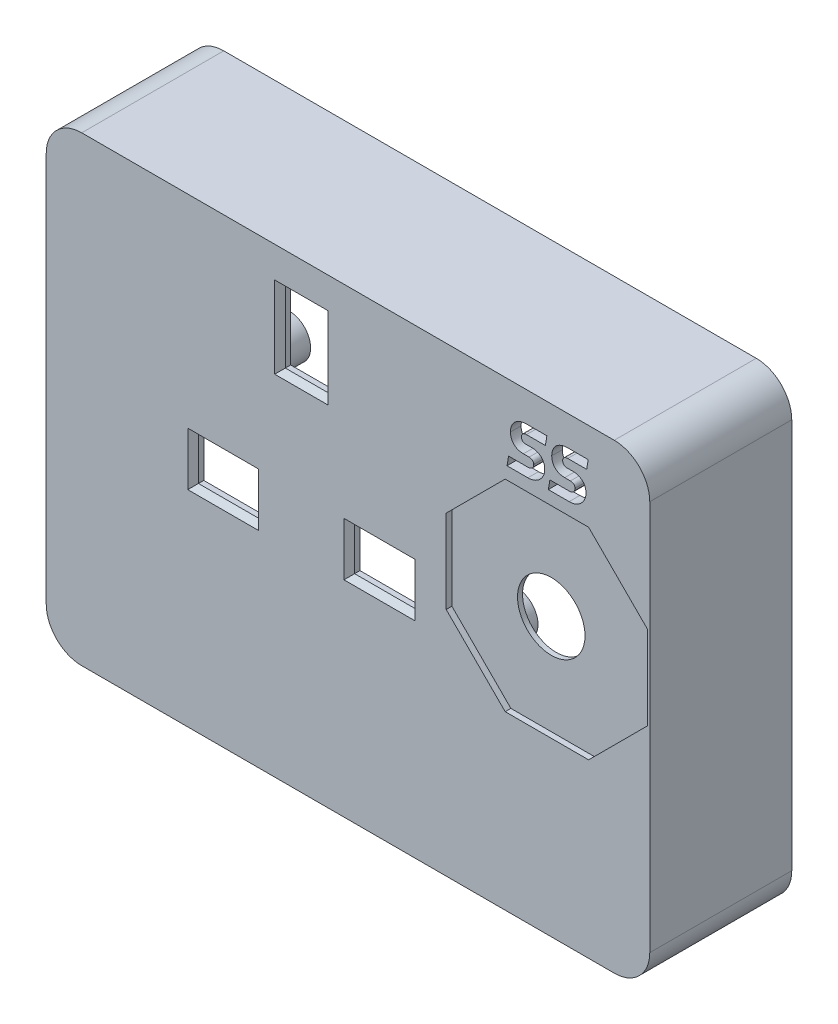
from build123d import *

# Parameters (mm, degrees)
BOSS_EXTRUDE1_DEPTH          = 20
SHELL5_T                     = -1.5
SKETCH2_W                    = 5.8
SKETCH2_H                    = 9.81
CUT_EXTRUDE2_DEPTH           = 0.8
CUT_EXTRUDE2_DRAFT           = -45
SKETCH2_W_2                  = 9.39
SKETCH2_H_2                  = 5.8
CUT_EXTRUDE2_PROFILE_2_DEPTH = 0.8
CUT_EXTRUDE2_PROFILE_2_DRAFT = -45
CUT_EXTRUDE2_PROFILE_3_DEPTH = 0.8
CUT_EXTRUDE2_PROFILE_3_DRAFT = -45
SKETCH11_W                   = 4.2
SKETCH11_H                   = 8.21
SKETCH11_W_2                 = 7.79
SKETCH11_H_2                 = 4.2
CUT_EXTRUDE3_DEPTH           = 2
CUT_EXTRUDE5_DEPTH           = 1.5
SKETCH18_W                   = 1
SKETCH18_H                   = 4
BOSS_EXTRUDE2_DEPTH          = 3
SKETCH19_W                   = 67.604409418
SKETCH19_H                   = 1.025126266
BOSS_EXTRUDE3_DEPTH          = 1
EXTRUDE_THIN2_OUTLINE_R      = 3
EXTRUDE_THIN2_OUTLINE_R_2    = 1.5
EXTRUDE_THIN2_DEPTH          = 7
SKETCH24_W                   = 3
SKETCH24_H                   = 1
BOSS_EXTRUDE8_DEPTH          = 3
BOSS_EXTRUDE9_DEPTH          = 4
SKETCH27_W                   = 1
SKETCH27_H                   = 4.5
BOSS_EXTRUDE10_DEPTH         = 4
SKETCH27_3_W                 = 1
SKETCH27_3_H                 = 3
BOSS_EXTRUDE11_DEPTH         = 2
SKETCH29_R                   = 4.75
CUT_EXTRUDE9_DEPTH           = 4
SKETCH33_W                   = 9.39
SKETCH33_H                   = 5.8
SKETCH33_W_2                 = 5.8
SKETCH33_H_2                 = 9.81
BOSS_EXTRUDE12_DEPTH         = 1.5
SKETCH34_W                   = 8.48
SKETCH34_H                   = 6
SKETCH34_W_2                 = 6.48
SKETCH34_H_2                 = 4
SKETCH34_W_3                 = 6
SKETCH34_H_3                 = 10
SKETCH34_W_4                 = 4
SKETCH34_H_4                 = 8
CUT_EXTRUDE11_DEPTH          = 1.5
CHAMFER1_SIZE                = 0.75
SKETCH35_R                   = 3
SKETCH35_R_2                 = 1.5
EXTRUDE_THIN3_DEPTH          = 7
CUT_EXTRUDE12_DEPTH          = 2
CUT_EXTRUDE13_DEPTH          = 0.8


# Read off the part's stored shape, not the designer's step: Extrude-Thin2
with BuildPart() as part:
    # Sketch1 → Boss-Extrude1 (new body)
    with BuildSketch(Plane.XY):
        with BuildLine():
            Line((5, 0), (80, 0))
            ThreePointArc((80, 0), (83.535533906, -1.464466094), (85, -5))
            Line((85, -5), (85, -60))
            ThreePointArc((85, -60), (83.535533906, -63.535533906), (80, -65))
            Line((80, -65), (5, -65))
            ThreePointArc((5, -65), (1.464466094, -63.535533906), (0, -60))
            Line((0, -60), (0, -5))
            ThreePointArc((0, -5), (1.464466094, -1.464466094), (5, 0))
        make_face()
    extrude(amount=BOSS_EXTRUDE1_DEPTH)

    # Shell5
    shell5_openings = [part.faces().sort_by_distance(p)[0] for p in [
        (42.5, -32.5, 0),
    ]]
    offset(amount=SHELL5_T, openings=shell5_openings, kind=Kind.INTERSECTION)


with BuildPart() as cut_extrude2_tool:
    # Sketch2 → Cut-Extrude2 (with draft: the straight prism first)
    with BuildSketch(Plane.XY.offset(20)):
        with Locations((35.750734439, -10.039101851)):
            Rectangle(SKETCH2_W, SKETCH2_H)
    extrude(amount=-CUT_EXTRUDE2_DEPTH)
    # Cut-Extrude2: the draft: its side faces are tilted about the plane it starts from
    cut_extrude2_sides = [cut_extrude2_tool.faces().sort_by_distance(p)[0] for p in [
        (35.750734439, -5.134101851, 19.6),
        (32.850734439, -10.039101851, 19.6),
        (35.750734439, -14.944101851, 19.6),
        (38.650734439, -10.039101851, 19.6),
    ]]
    draft(cut_extrude2_sides, Plane.XY.offset(20), CUT_EXTRUDE2_DRAFT)


with BuildPart() as part_1:
    add(part.part)

    # Cut-Extrude2: cut by cut_extrude2_tool
    add(cut_extrude2_tool.part, mode=Mode.SUBTRACT)


with BuildPart() as cut_extrude2_profile_2_tool:
    # Sketch2 → Cut-Extrude2 profile 2 (with draft: the straight prism first)
    with BuildSketch(Plane.XY.offset(20)):
        with Locations((24.750734439, -32.439587307)):
            Rectangle(SKETCH2_W_2, SKETCH2_H_2)
    extrude(amount=-CUT_EXTRUDE2_PROFILE_2_DEPTH)
    # Cut-Extrude2 profile 2: the draft: its side faces are tilted about the plane it starts from
    cut_extrude2_profile_2_sides = [cut_extrude2_profile_2_tool.faces().sort_by_distance(p)[0] for p in [
        (20.055734439, -32.439587307, 19.6),
        (24.750734439, -35.339587307, 19.6),
        (29.445734439, -32.439587307, 19.6),
        (24.750734439, -29.539587307, 19.6),
    ]]
    draft(cut_extrude2_profile_2_sides, Plane.XY.offset(20), CUT_EXTRUDE2_PROFILE_2_DRAFT)


with BuildPart() as part_2:
    add(part_1.part)

    # Cut-Extrude2 profile 2: cut by cut_extrude2_profile_2_tool
    add(cut_extrude2_profile_2_tool.part, mode=Mode.SUBTRACT)


with BuildPart() as cut_extrude2_profile_3_tool:
    # Sketch2 → Cut-Extrude2 profile 3 (with draft: the straight prism first)
    with BuildSketch(Plane.XY.offset(20)):
        with Locations((45.820734439, -32.151016376)):
            Rectangle(SKETCH2_W_2, SKETCH2_H_2)
    extrude(amount=-CUT_EXTRUDE2_PROFILE_3_DEPTH)
    # Cut-Extrude2 profile 3: the draft: its side faces are tilted about the plane it starts from
    cut_extrude2_profile_3_sides = [cut_extrude2_profile_3_tool.faces().sort_by_distance(p)[0] for p in [
        (45.820734439, -35.051016376, 19.6),
        (50.515734439, -32.151016376, 19.6),
        (45.820734439, -29.251016376, 19.6),
        (41.125734439, -32.151016376, 19.6),
    ]]
    draft(cut_extrude2_profile_3_sides, Plane.XY.offset(20), CUT_EXTRUDE2_PROFILE_3_DRAFT)


with BuildPart() as part_3:
    add(part_2.part)

    # Cut-Extrude2 profile 3: cut by cut_extrude2_profile_3_tool
    add(cut_extrude2_profile_3_tool.part, mode=Mode.SUBTRACT)

    # Sketch11 → Cut-Extrude3 (cut)
    with BuildSketch(Plane.XY.offset(20)):
        with Locations((35.750734439, -10.039101851)):
            Rectangle(SKETCH11_W, SKETCH11_H)
        with Locations((45.820734439, -32.151016376)):
            Rectangle(SKETCH11_W_2, SKETCH11_H_2)
        with Locations((24.750734439, -32.439587307)):
            Rectangle(SKETCH11_W_2, SKETCH11_H_2)
    extrude(amount=-CUT_EXTRUDE3_DEPTH, mode=Mode.SUBTRACT)

    # Sketch12 → Cut-Extrude5 (cut)
    with BuildSketch(Plane(origin=(0, 0, 0), x_dir=(-1, 0, 0), z_dir=(0, 0, -1))):
        with BuildLine():
            Line((-1, -60), (-1, -5))
            ThreePointArc((-1, -5), (-2.171572875, -2.171572875), (-5, -1))
            Line((-5, -1), (-80, -1))
            ThreePointArc((-80, -1), (-82.828427125, -2.171572875), (-84, -5))
            Line((-84, -5), (-84, -60))
            ThreePointArc((-84, -60), (-82.828427125, -62.828427125), (-80, -64))
            Line((-80, -64), (-5, -64))
            ThreePointArc((-5, -64), (-2.171572875, -62.828427125), (-1, -60))
        make_face()
    extrude(amount=-CUT_EXTRUDE5_DEPTH, mode=Mode.SUBTRACT)

    # Sketch18 → Boss-Extrude2 (add)
    with BuildSketch(Plane(origin=(0, 0, 18.5), x_dir=(-1, 0, 0), z_dir=(0, 0, -1))):
        with Locations((-20.291181164, -61.5)):
            Rectangle(SKETCH18_W, SKETCH18_H)
        with Locations((-43.743706014, -61.5)):
            Rectangle(SKETCH18_W, SKETCH18_H)
        with Locations((-52.686382066, -61.5)):
            Rectangle(SKETCH18_W, SKETCH18_H)
        with Locations((-72.486417139, -61.5)):
            Rectangle(SKETCH18_W, SKETCH18_H)
    extrude(amount=BOSS_EXTRUDE2_DEPTH)

    # Sketch19 → Boss-Extrude3 (add)
    with BuildSketch(Plane(origin=(0, 0, 18.5), x_dir=(-1, 0, 0), z_dir=(0, 0, -1))):
        with Locations((-46.197795291, -62.987436867)):
            Rectangle(SKETCH19_W, SKETCH19_H)
    extrude(amount=BOSS_EXTRUDE3_DEPTH)

    # Extrude-Thin2 outline → Extrude-Thin2 (add)
    # profile 1 of 3: a face of its own
    with BuildSketch(Plane(origin=(0, 0, 18.5), x_dir=(-1, 0, 0), z_dir=(0, 0, -1))):
        with Locations((-58.013044206, -7.100045218)):
            Circle(EXTRUDE_THIN2_OUTLINE_R)
        with Locations((-58.013044206, -7.100045218)):
            Circle(EXTRUDE_THIN2_OUTLINE_R_2, mode=Mode.SUBTRACT)
    # profile 2 of 3: a face of its own
    with BuildSketch(Plane(origin=(0, 0, 18.5), x_dir=(-1, 0, 0), z_dir=(0, 0, -1))):
        with Locations((-57.762473778, -36.347616319)):
            Circle(EXTRUDE_THIN2_OUTLINE_R)
        with Locations((-57.762473778, -36.347616319)):
            Circle(EXTRUDE_THIN2_OUTLINE_R_2, mode=Mode.SUBTRACT)
    # profile 3 of 3: a face of its own
    with BuildSketch(Plane(origin=(0, 0, 18.5), x_dir=(-1, 0, 0), z_dir=(0, 0, -1))):
        with Locations((-80.011530807, -7.095829284)):
            Circle(EXTRUDE_THIN2_OUTLINE_R)
        with Locations((-80.011530807, -7.095829284)):
            Circle(EXTRUDE_THIN2_OUTLINE_R_2, mode=Mode.SUBTRACT)
    extrude(amount=EXTRUDE_THIN2_DEPTH)

    # Sketch24 → Boss-Extrude8 (add)
    with BuildSketch(Plane(origin=(0, 0, 18.5), x_dir=(-1, 0, 0), z_dir=(0, 0, -1))):
        with Locations((-3, -15.410950244)):
            Rectangle(SKETCH24_W, SKETCH24_H)
        with Locations((-3, -33)):
            Rectangle(SKETCH24_W, SKETCH24_H)
        with Locations((-3, -41.503906467)):
            Rectangle(SKETCH24_W, SKETCH24_H)
    extrude(amount=BOSS_EXTRUDE8_DEPTH)

    # Sketch25 → Boss-Extrude9 (add)
    with BuildSketch(Plane(origin=(0, 0, 18.5), x_dir=(-1, 0, 0), z_dir=(0, 0, -1))):
        Polygon((-5, -58.3), (-6.3, -58.3), (-6.3, -63.5), (-5, -63.5), (-1.477724986, -63.5), (-1.477724986, -58.3), align=None)
    extrude(amount=BOSS_EXTRUDE9_DEPTH)

    # Sketch27 → Boss-Extrude10 (add)
    with BuildSketch(Plane(origin=(0, 0, 18.5), x_dir=(-1, 0, 0), z_dir=(0, 0, -1))):
        Polygon((-7.590273025, -58.3), (-6.3, -58.3), (-6.090273025, -58.3), (-6.090273025, -53.8), (-7.590273025, -53.8), align=None)
        with Locations((-3.090273025, -56.05)):
            Rectangle(SKETCH27_W, SKETCH27_H)
    extrude(amount=BOSS_EXTRUDE10_DEPTH)

    # Sketch27<3> → Boss-Extrude11 (add)
    with BuildSketch(Plane(origin=(0, 0, 18.5), x_dir=(-1, 0, 0), z_dir=(0, 0, -1))):
        Polygon((-7.623895655, -37.278874561), (-6.33362263, -37.278874561), (-6.123895655, -37.278874561), (-6.123895655, -34.278874561), (-7.623895655, -34.278874561), align=None)
        with Locations((-3.123895655, -35.778874561)):
            Rectangle(SKETCH27_3_W, SKETCH27_3_H)
        Polygon((-7.295852062, -21.696517585), (-6.005579038, -21.696517585), (-5.795852062, -21.696517585), (-5.795852062, -18.696517585), (-7.295852062, -18.696517585), align=None)
        with Locations((-2.795852062, -20.196517585)):
            Rectangle(SKETCH27_3_W, SKETCH27_3_H)
    extrude(amount=BOSS_EXTRUDE11_DEPTH)

    # Sketch29 → Cut-Extrude9 (cut)
    with BuildSketch(Plane.XY.offset(20)):
        with Locations((70.328450686, -26.717149062)):
            Circle(SKETCH29_R)
    extrude(amount=-CUT_EXTRUDE9_DEPTH, mode=Mode.SUBTRACT)

    # Sketch33 → Boss-Extrude12 (add)
    with BuildSketch(Plane.XY.offset(20)):
        with Locations((24.750734439, -32.439587307)):
            Rectangle(SKETCH33_W, SKETCH33_H)
        with Locations((45.820734439, -32.151016376)):
            Rectangle(SKETCH33_W, SKETCH33_H)
        with Locations((35.750734439, -10.039101851)):
            Rectangle(SKETCH33_W_2, SKETCH33_H_2)
    extrude(amount=-BOSS_EXTRUDE12_DEPTH)

    # Sketch34 → Cut-Extrude11 (cut)
    # profile 1 of 6: a face of its own
    with BuildSketch(Plane.XY.offset(20)):
        with Locations((46.925110998, -32.304599148)):
            Rectangle(SKETCH34_W, SKETCH34_H)
        with Locations((46.925110998, -32.304599148)):
            Rectangle(SKETCH34_W_2, SKETCH34_H_2, mode=Mode.SUBTRACT)
    # profile 2 of 6: a face of its own
    with BuildSketch(Plane.XY.offset(20)):
        with Locations((46.925110998, -32.304599148)):
            Rectangle(SKETCH34_W_2, SKETCH34_H_2)
    # profile 3 of 6: a face of its own
    with BuildSketch(Plane.XY.offset(20)):
        with Locations((24.925110998, -32.304599148)):
            Rectangle(SKETCH34_W, SKETCH34_H)
        with Locations((24.925110998, -32.304599148)):
            Rectangle(SKETCH34_W_2, SKETCH34_H_2, mode=Mode.SUBTRACT)
    # profile 4 of 6: a face of its own
    with BuildSketch(Plane.XY.offset(20)):
        with Locations((24.925110998, -32.304599148)):
            Rectangle(SKETCH34_W_2, SKETCH34_H_2)
    # profile 5 of 6: a face of its own
    with BuildSketch(Plane.XY.offset(20)):
        with Locations((35.925110998, -10.104599148)):
            Rectangle(SKETCH34_W_3, SKETCH34_H_3)
        with Locations((35.925110998, -10.104599148)):
            Rectangle(SKETCH34_W_4, SKETCH34_H_4, mode=Mode.SUBTRACT)
    # profile 6 of 6: a face of its own
    with BuildSketch(Plane.XY.offset(20)):
        with Locations((35.925110998, -10.104599148)):
            Rectangle(SKETCH34_W_4, SKETCH34_H_4)
    extrude(amount=-CUT_EXTRUDE11_DEPTH, mode=Mode.SUBTRACT)

    # Chamfer1
    chamfer1_edges = [part_3.edges().sort_by_distance(p)[0] for p in [
        (42.685110998, -32.304599148, 20),
        (46.925110998, -29.304599148, 20),
        (51.165110998, -32.304599148, 20),
        (46.925110998, -35.304599148, 20),
        (20.685110998, -32.304599148, 20),
        (24.925110998, -29.304599148, 20),
        (29.165110998, -32.304599148, 20),
        (24.925110998, -35.304599148, 20),
        (32.925110998, -10.104599148, 20),
        (35.925110998, -15.104599148, 20),
        (38.925110998, -10.104599148, 20),
        (35.925110998, -5.104599148, 20),
    ]]
    chamfer(chamfer1_edges, length=CHAMFER1_SIZE)

    # Sketch35 → Extrude-Thin3 (add)
    # profile 1 of 2: a face of its own
    with BuildSketch(Plane(origin=(0, 0, 18.5), x_dir=(-1, 0, 0), z_dir=(0, 0, -1))):
        with Locations((-25.737610309, -18.622939682)):
            Circle(SKETCH35_R)
        with Locations((-25.737610309, -18.622939682)):
            Circle(SKETCH35_R_2, mode=Mode.SUBTRACT)
    # profile 2 of 2: a face of its own
    with BuildSketch(Plane(origin=(0, 0, 18.5), x_dir=(-1, 0, 0), z_dir=(0, 0, -1))):
        with Locations((-46.08232423, -18.622939682)):
            Circle(SKETCH35_R)
        with Locations((-46.08232423, -18.622939682)):
            Circle(SKETCH35_R_2, mode=Mode.SUBTRACT)
    extrude(amount=EXTRUDE_THIN3_DEPTH)

    # Sketch37 → Cut-Extrude12 (cut)
    with BuildSketch(Plane.XY.offset(20)):
        with BuildLine():
            Line((64.89804713, -10.661370231), (65.119799828, -9.368258109))
            Line((65.119799828, -9.368258109), (67.824915579, -9.368258109))
            add(Edge.make_bspline(
                [(67.824915579, -9.368258109), (67.869507816, -9.366956356), (67.95510518, -9.364457566), (68.077739329, -9.3460825), (68.188278875, -9.314105443), (68.287012833, -9.269570527), (68.373868451, -9.214705621), (68.449784089, -9.151675241), (68.513169063, -9.079700136), (68.5661532, -9.000503764), (68.605525641, -8.912995962), (68.635404062, -8.820380769), (68.653180335, -8.721937237), (68.654928902, -8.654535876), (68.655820268, -8.620176717)],
                knots=[0, 0, 0, 0, 1.27205421, 2.441781226, 3.527268806, 4.545070772, 5.521431157, 6.450263402, 7.350234904, 8.248770471, 9.158286513, 10.078388938, 11.020421243, 12, 12, 12, 12], degree=3))
            add(Edge.make_bspline(
                [(68.655820268, -8.620176717), (68.654750887, -8.593383486), (68.652649141, -8.54072446), (68.637314549, -8.464008973), (68.613933739, -8.391096613), (68.57828023, -8.32430198), (68.535645704, -8.262531684), (68.484686721, -8.206663159), (68.423599762, -8.160576285), (68.356448087, -8.11970614), (68.281004719, -8.087369286), (68.197238176, -8.06547006), (68.106032403, -8.04971636), (68.042289765, -8.048868222), (68.009264208, -8.048428795)],
                knots=[0, 0, 0, 0, 0.992737827, 1.951112461, 2.890820332, 3.821200847, 4.746293398, 5.669173687, 6.610330608, 7.572961552, 8.578790993, 9.640127401, 10.777331635, 12, 12, 12, 12], degree=3))
            Line((68.009264208, -8.048428795), (67.20641257, -8.048428795))
            add(Edge.make_bspline(
                [(67.20641257, -8.048428795), (67.118067454, -8.046080098), (66.946205828, -8.041511075), (66.69718873, -7.999785716), (66.463901367, -7.935841113), (66.249746716, -7.841279157), (66.05409004, -7.724141239), (65.882138433, -7.580486454), (65.730238497, -7.416187288), (65.603184427, -7.22848126), (65.503346538, -7.020739535), (65.430299463, -6.796300716), (65.387240059, -6.555248987), (65.381764116, -6.389021215), (65.378956596, -6.303796119)],
                knots=[0, 0, 0, 0, 1.116581574, 2.172135068, 3.184821365, 4.168429248, 5.123717561, 6.059734952, 6.992493315, 7.945387834, 8.915192859, 9.898349147, 10.92248211, 12, 12, 12, 12], degree=3))
            add(Edge.make_bspline(
                [(65.378956596, -6.303796119), (65.379463721, -6.252102421), (65.380462673, -6.150274186), (65.396200837, -6.000437261), (65.419157485, -5.855149354), (65.448417541, -5.713937711), (65.491311482, -5.578426895), (65.539927033, -5.447149978), (65.599367501, -5.320965924), (65.689555264, -5.160075381), (65.822141823, -4.972510519), (66.011447728, -4.772876822), (66.227840555, -4.599446767), (66.471597401, -4.454605937), (66.738993739, -4.340284011), (67.027763325, -4.257016974), (67.336905542, -4.206806547), (67.549982376, -4.201303726), (67.659268985, -4.198481342)],
                knots=[0, 0, 0, 0, 0.711262118, 1.401071501, 2.071210603, 2.736058755, 3.383644841, 4.025724911, 4.66189709, 5.301309205, 6.563231443, 7.811969873, 9.076524263, 10.368457937, 11.702892695, 13.068552058, 14.496467234, 16, 16, 16, 16], degree=3))
            Line((67.659268985, -4.198481342), (70.512665154, -4.198481342))
            Line((70.512665154, -4.198481342), (70.300263473, -5.490257604))
            Line((70.300263473, -5.490257604), (67.64056695, -5.490257604))
            add(Edge.make_bspline(
                [(67.64056695, -5.490257604), (67.60486714, -5.491182316), (67.535315357, -5.492983878), (67.435143311, -5.509836237), (67.341517311, -5.534001696), (67.257444799, -5.572521637), (67.181074864, -5.617535227), (67.113221414, -5.670446607), (67.053779982, -5.730327461), (67.005773651, -5.798900369), (66.968612265, -5.873033872), (66.939676378, -5.950687244), (66.923584299, -6.033292626), (66.921564266, -6.089548242), (66.920538609, -6.11811163)],
                knots=[0, 0, 0, 0, 1.199394475, 2.336707822, 3.408349642, 4.440668293, 5.434477058, 6.383981286, 7.326374798, 8.261123927, 9.185258786, 10.108908281, 11.039811679, 12, 12, 12, 12], degree=3))
            add(Edge.make_bspline(
                [(66.920538609, -6.11811163), (66.921552494, -6.148018288), (66.923502689, -6.205543387), (66.938814946, -6.288525895), (66.962245072, -6.364739267), (67.006557084, -6.45558997), (67.08543831, -6.550883704), (67.203966, -6.636804899), (67.342826892, -6.691108869), (67.441938201, -6.697367207), (67.492286531, -6.700546429)],
                knots=[0, 0, 0, 0, 0.784419062, 1.508820697, 2.207402468, 2.871195857, 4.15068875, 5.406042166, 6.682275063, 8, 8, 8, 8], degree=3))
            Line((67.492286531, -6.700546429), (68.351244273, -6.700546429))
            add(Edge.make_bspline(
                [(68.351244273, -6.700546429), (68.444918585, -6.702836462), (68.626568797, -6.707277221), (68.888573783, -6.749303154), (69.130096562, -6.81806425), (69.349087554, -6.916234693), (69.545418302, -7.038682273), (69.719619966, -7.181846391), (69.868203724, -7.348434087), (69.99108104, -7.535080443), (70.089357112, -7.738876762), (70.15845705, -7.958415177), (70.20133339, -8.192362604), (70.205798015, -8.353259487), (70.208089158, -8.435828088)],
                knots=[0, 0, 0, 0, 1.176284817, 2.281013668, 3.323925309, 4.323195848, 5.28575007, 6.22347881, 7.146724317, 8.079348252, 9.022784807, 9.980055963, 10.963410919, 12, 12, 12, 12], degree=3))
            add(Edge.make_bspline(
                [(70.208089158, -8.435828088), (70.20606754, -8.506308378), (70.202041622, -8.646665143), (70.168463867, -8.85524147), (70.115198473, -9.06028972), (70.039977423, -9.260604751), (69.945841714, -9.453609229), (69.831774532, -9.636524557), (69.703034857, -9.811035859), (69.553609918, -9.972218769), (69.389975077, -10.122098567), (69.209804364, -10.256661928), (69.013546877, -10.373738236), (68.804396058, -10.477255274), (68.580578309, -10.560913948), (68.342985823, -10.619105584), (68.092710745, -10.654536788), (67.92166155, -10.659059448), (67.834266596, -10.661370231)],
                knots=[0, 0, 0, 0, 0.93595899, 1.863899485, 2.799503141, 3.746762443, 4.701933034, 5.647639147, 6.607251694, 7.578700232, 8.562874189, 9.552067709, 10.560604051, 11.595146428, 12.649046206, 13.728086123, 14.839200558, 16, 16, 16, 16], degree=3))
            Line((67.834266596, -10.661370231), (64.89804713, -10.661370231))
        make_face()
        with BuildLine():
            Line((70.711708239, -10.661370231), (70.933460937, -9.368258109))
            Line((70.933460937, -9.368258109), (73.638576687, -9.368258109))
            add(Edge.make_bspline(
                [(73.638576687, -9.368258109), (73.683168925, -9.366956356), (73.768766289, -9.364457566), (73.891400438, -9.3460825), (74.001939984, -9.314105443), (74.100673942, -9.269570527), (74.187529559, -9.214705621), (74.263445198, -9.151675241), (74.326830172, -9.079700136), (74.379814309, -9.000503764), (74.41918675, -8.912995962), (74.449065171, -8.820380769), (74.466841444, -8.721937237), (74.468590011, -8.654535876), (74.469481377, -8.620176717)],
                knots=[0, 0, 0, 0, 1.27205421, 2.441781226, 3.527268806, 4.545070772, 5.521431157, 6.450263402, 7.350234904, 8.248770471, 9.158286513, 10.078388938, 11.020421243, 12, 12, 12, 12], degree=3))
            add(Edge.make_bspline(
                [(74.469481377, -8.620176717), (74.468411996, -8.593383486), (74.46631025, -8.54072446), (74.450975658, -8.464008973), (74.427594848, -8.391096613), (74.391941339, -8.32430198), (74.349306813, -8.262531684), (74.29834783, -8.206663159), (74.237260871, -8.160576285), (74.170109196, -8.11970614), (74.094665828, -8.087369286), (74.010899285, -8.06547006), (73.919693512, -8.04971636), (73.855950874, -8.048868222), (73.822925316, -8.048428795)],
                knots=[0, 0, 0, 0, 0.992737827, 1.951112461, 2.890820332, 3.821200847, 4.746293398, 5.669173687, 6.610330608, 7.572961552, 8.578790993, 9.640127401, 10.777331635, 12, 12, 12, 12], degree=3))
            Line((73.822925316, -8.048428795), (73.020073679, -8.048428795))
            add(Edge.make_bspline(
                [(73.020073679, -8.048428795), (72.931728563, -8.046080098), (72.759866937, -8.041511075), (72.510849839, -7.999785716), (72.277562476, -7.935841113), (72.063407825, -7.841279157), (71.867751149, -7.724141239), (71.695799542, -7.580486454), (71.543899606, -7.416187288), (71.416845536, -7.22848126), (71.317007647, -7.020739535), (71.243960571, -6.796300716), (71.200901167, -6.555248987), (71.195425225, -6.389021215), (71.192617705, -6.303796119)],
                knots=[0, 0, 0, 0, 1.116581574, 2.172135068, 3.184821365, 4.168429248, 5.123717561, 6.059734952, 6.992493315, 7.945387834, 8.915192859, 9.898349147, 10.92248211, 12, 12, 12, 12], degree=3))
            add(Edge.make_bspline(
                [(71.192617705, -6.303796119), (71.193124829, -6.252102421), (71.194123782, -6.150274186), (71.209861946, -6.000437261), (71.232818594, -5.855149354), (71.26207865, -5.713937711), (71.304972591, -5.578426895), (71.353588141, -5.447149978), (71.41302861, -5.320965924), (71.503216373, -5.160075381), (71.635802932, -4.972510519), (71.825108837, -4.772876822), (72.041501664, -4.599446767), (72.285258509, -4.454605937), (72.552654848, -4.340284011), (72.841424433, -4.257016974), (73.150566651, -4.206806547), (73.363643485, -4.201303726), (73.472930093, -4.198481342)],
                knots=[0, 0, 0, 0, 0.711262118, 1.401071501, 2.071210603, 2.736058755, 3.383644841, 4.025724911, 4.66189709, 5.301309205, 6.563231443, 7.811969873, 9.076524263, 10.368457937, 11.702892695, 13.068552058, 14.496467234, 16, 16, 16, 16], degree=3))
            Line((73.472930093, -4.198481342), (76.326326263, -4.198481342))
            Line((76.326326263, -4.198481342), (76.113924581, -5.490257604))
            Line((76.113924581, -5.490257604), (73.454228059, -5.490257604))
            add(Edge.make_bspline(
                [(73.454228059, -5.490257604), (73.418528249, -5.491182316), (73.348976466, -5.492983878), (73.24880442, -5.509836237), (73.155178419, -5.534001696), (73.071105908, -5.572521637), (72.994735973, -5.617535227), (72.926882523, -5.670446607), (72.86744109, -5.730327461), (72.81943476, -5.798900369), (72.782273374, -5.873033872), (72.753337487, -5.950687244), (72.737245408, -6.033292626), (72.735225375, -6.089548242), (72.734199718, -6.11811163)],
                knots=[0, 0, 0, 0, 1.199394475, 2.336707822, 3.408349642, 4.440668293, 5.434477058, 6.383981286, 7.326374798, 8.261123927, 9.185258786, 10.108908281, 11.039811679, 12, 12, 12, 12], degree=3))
            add(Edge.make_bspline(
                [(72.734199718, -6.11811163), (72.735213603, -6.148018288), (72.737163798, -6.205543387), (72.752476055, -6.288525895), (72.775906181, -6.364739267), (72.820218193, -6.45558997), (72.899099418, -6.550883704), (73.017627109, -6.636804899), (73.156488001, -6.691108869), (73.25559931, -6.697367207), (73.30594764, -6.700546429)],
                knots=[0, 0, 0, 0, 0.784419062, 1.508820697, 2.207402468, 2.871195857, 4.15068875, 5.406042166, 6.682275063, 8, 8, 8, 8], degree=3))
            Line((73.30594764, -6.700546429), (74.164905382, -6.700546429))
            add(Edge.make_bspline(
                [(74.164905382, -6.700546429), (74.258579694, -6.702836462), (74.440229906, -6.707277221), (74.702234892, -6.749303154), (74.943757671, -6.81806425), (75.162748662, -6.916234693), (75.359079411, -7.038682273), (75.533281075, -7.181846391), (75.681864833, -7.348434087), (75.804742149, -7.535080443), (75.903018221, -7.738876762), (75.972118159, -7.958415177), (76.014994498, -8.192362604), (76.019459123, -8.353259487), (76.021750267, -8.435828088)],
                knots=[0, 0, 0, 0, 1.176284817, 2.281013668, 3.323925309, 4.323195848, 5.28575007, 6.22347881, 7.146724317, 8.079348252, 9.022784807, 9.980055963, 10.963410919, 12, 12, 12, 12], degree=3))
            add(Edge.make_bspline(
                [(76.021750267, -8.435828088), (76.019728648, -8.506308378), (76.015702731, -8.646665143), (75.982124976, -8.85524147), (75.928859581, -9.06028972), (75.853638532, -9.260604751), (75.759502823, -9.453609229), (75.645435641, -9.636524557), (75.516695966, -9.811035859), (75.367271027, -9.972218769), (75.203636186, -10.122098567), (75.023465473, -10.256661928), (74.827207986, -10.373738236), (74.618057167, -10.477255274), (74.394239417, -10.560913948), (74.156646932, -10.619105584), (73.906371854, -10.654536788), (73.735322659, -10.659059448), (73.647927705, -10.661370231)],
                knots=[0, 0, 0, 0, 0.93595899, 1.863899485, 2.799503141, 3.746762443, 4.701933034, 5.647639147, 6.607251694, 7.578700232, 8.562874189, 9.552067709, 10.560604051, 11.595146428, 12.649046206, 13.728086123, 14.839200558, 16, 16, 16, 16], degree=3))
            Line((73.647927705, -10.661370231), (70.711708239, -10.661370231))
        make_face()
    extrude(amount=-CUT_EXTRUDE12_DEPTH, mode=Mode.SUBTRACT)

    # Sketch38 → Cut-Extrude13 (cut)
    with BuildSketch(Plane.XY.offset(20)):
        Polygon((56.328916584, -20.72389063), (64.638462027, -12.414345187), (76.38993389, -12.414345187), (84.699479332, -20.72389063), (84.699479332, -32.475362492), (76.38993389, -40.784907935), (64.638462027, -40.784907935), (56.328916584, -32.475362492), align=None)
    extrude(amount=-CUT_EXTRUDE13_DEPTH, mode=Mode.SUBTRACT)


solid = part_3.part
